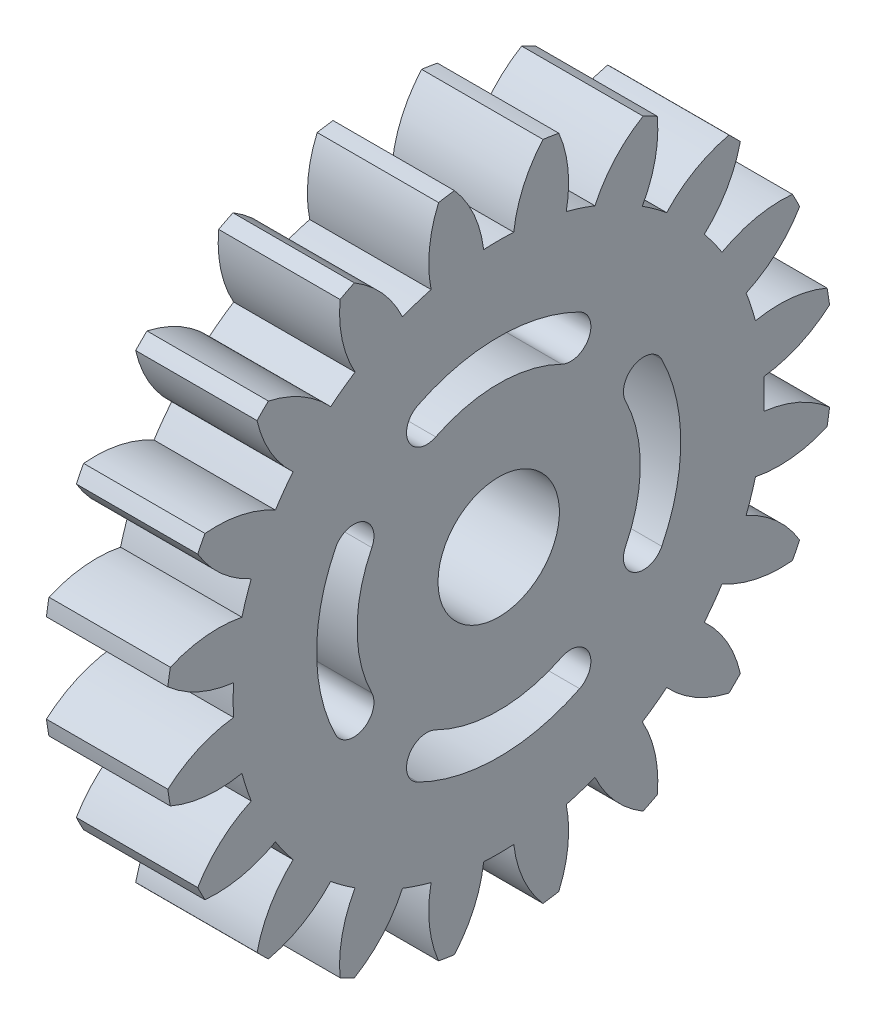
from build123d import *

# Parameters (mm, degrees)
BASPROSKE_W        = 6
BASPROSKE_H        = 16.5
TOOTHCUT_DEPTH     = 25.093567606
TEETHCUTS_COUNT    = 20
TEETHCUTS_ANGLE    = 342
BORSKE_R           = 3
BORE_DEPTH         = 50.0000508
CUT_EXTRUDE1_DEPTH = 10
CIRPATTERN1_COUNT  = 4


with BuildPart() as part:
    # BasProSke → Base-Revolve (revolve)
    with BuildSketch(Plane(origin=(0, 0, 0), x_dir=(1, 0, 0), z_dir=(0, 1, 0))):
        with Locations((3, 8.25)):
            Rectangle(BASPROSKE_W, BASPROSKE_H)
    revolve(axis=Axis((-10, 0, 0), (1, 0, 0)))

    # TooCutSke → ToothCut (cut, through all)
    with BuildSketch(Plane(origin=(0, 0, 0), x_dir=(0, 0, -1), z_dir=(1, 0, 0))):
        with BuildLine():
            ThreePointArc((0.74381438, 13.102904875), (0, 13.124), (-0.74381438, 13.102904875))
            ThreePointArc((-0.74381438, 13.102904875), (-1.226473103, 14.852072512), (-2.209965745, 16.376962373))
            ThreePointArc((-2.209965745, 16.376962373), (0, 16.5254), (2.209965745, 16.376962373))
            ThreePointArc((2.209965745, 16.376962373), (1.226473103, 14.852072512), (0.74381438, 13.102904875))
        make_face()
    toothcut = extrude(amount=TOOTHCUT_DEPTH, mode=Mode.SUBTRACT)

    # TeethCuts: ToothCut ×20 about axis
    teethcuts_axis = Axis((-10, 0, 0), (1, 0, 0))
    for i in range(1, TEETHCUTS_COUNT):
        add(toothcut.rotate(teethcuts_axis, i * TEETHCUTS_ANGLE / (TEETHCUTS_COUNT - 1)), mode=Mode.SUBTRACT)

    # BorSke → Bore (cut, symmetric)
    with BuildSketch(Plane(origin=(0, 0, 0), x_dir=(0, 0, -1), z_dir=(1, 0, 0))):
        Circle(BORSKE_R)
    extrude(amount=BORE_DEPTH, both=True, mode=Mode.SUBTRACT)

    # Sketch1 → Cut-Extrude1 (cut)
    with BuildSketch(Plane(origin=(6, 0, 0), x_dir=(0, 0, -1), z_dir=(1, 0, 0))):
        with BuildLine():
            ThreePointArc((4, 8.062257748), (0, 9), (-4, 8.062257748))
            ThreePointArc((-4, 8.062257748), (-4.451361972, 6.722006887), (-3.111111111, 6.270644915))
            ThreePointArc((-3.111111111, 6.270644915), (0, 7), (3.111111111, 6.270644915))
            ThreePointArc((3.111111111, 6.270644915), (4.451361972, 6.722006887), (4, 8.062257748))
        make_face()
    cut_extrude1 = extrude(amount=-CUT_EXTRUDE1_DEPTH, mode=Mode.SUBTRACT)

    # CirPattern1: Cut-Extrude1 ×4 about axis
    cirpattern1_axis = Axis((6, 0, 0), (1, 0, 0))
    for i in range(1, CIRPATTERN1_COUNT):
        add(cut_extrude1.rotate(cirpattern1_axis, i * 360 / CIRPATTERN1_COUNT), mode=Mode.SUBTRACT)


solid = part.part
